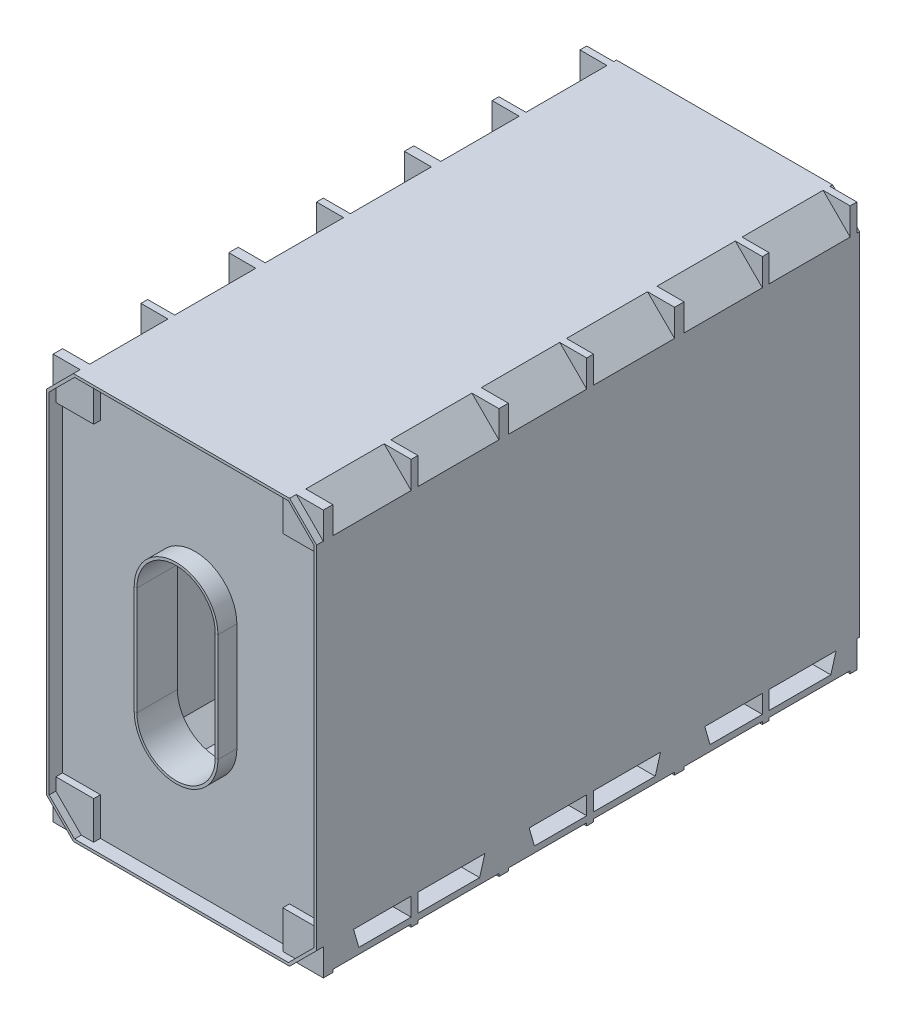
from build123d import *

# Parameters (mm, degrees)
SKETCH_1_W               = 200
SKETCH_1_H               = 300
EXTRUDE_1_DEPTH          = 2
CHAMFER_1_SIZE           = 20
EXTRUDE_2_DEPTH          = 400
PATTERN_START            = 130
PATTERN_LINEAR_1_DEPTH   = 2
PATTERN_START_2          = 260
PATTERN_LINEAR_1_2_DEPTH = 2
PATTERN_START_3          = 390
PATTERN_LINEAR_1_3_DEPTH = 2
SKETCH_4_W               = 2
SKETCH_4_H               = 30
PATTERN_LINEAR_2_COUNT   = 4
PATTERN_LINEAR_2_PITCH   = 130
EXTRUDE_7_DEPTH          = 100
PATTERN_LINEAR_3_COUNT   = 3
PATTERN_LINEAR_3_PITCH   = 130
SKETCH_6_W               = 30
SKETCH_6_H               = 30
EXTRUDE_8_DEPTH          = 5
PATTERN_LINEAR_4_COUNT   = 7
PATTERN_LINEAR_4_PITCH   = 65


# Read off the part's stored shape, not the designer's step: 阵列(线性)1
with BuildPart() as part:
    # 草图1 → 凸台-拉伸1 (new body)
    with BuildSketch(Plane.XY):
        Rectangle(SKETCH_1_W, SKETCH_1_H)
        with BuildLine():
            Line((30, 40), (30, -40))
            ThreePointArc((30, -40), (0, -70), (-30, -40))
            Line((-30, -40), (-30, 40))
            ThreePointArc((-30, 40), (0, 70), (30, 40))
        make_face(mode=Mode.SUBTRACT)
    extrude(amount=EXTRUDE_1_DEPTH)

    # 倒角1
    chamfer_1_edges = [part.edges().sort_by_distance(p)[0] for p in [
        (-100, 150, 1),
        (100, 150, 1),
        (100, -150, 1),
        (-100, -150, 1),
    ]]
    chamfer(chamfer_1_edges, length=CHAMFER_1_SIZE)

    # 草图3 → 凸台-拉伸2 (add)
    with BuildSketch(Plane.XY.offset(2)):
        Polygon((-80, -150), (80, -150), (100, -130), (100, 130), (80, 150), (-80, 150), (-100, 130), (-100, -130), align=None)
        Polygon((-79.171572875, -148), (79.171572875, -148), (98, -129.171572875), (98, 129.171572875), (79.171572875, 148), (-79.171572875, 148), (-98, 129.171572875), (-98, -129.171572875), align=None, mode=Mode.SUBTRACT)
    extrude(amount=EXTRUDE_2_DEPTH)

    # 阵列(线性)1 outline → 阵列(线性)1 (add)
    # profile 1 of 5: a face of its own
    with BuildSketch(Plane.XY.offset(PATTERN_START)):
        Polygon((100, -150), (100, -130), (80, -150), align=None)
    # profile 2 of 5: a face of its own
    with BuildSketch(Plane.XY.offset(PATTERN_START)):
        Polygon((80, 150), (100, 130), (100, 150), align=None)
    # profile 3 of 5: a face of its own
    with BuildSketch(Plane.XY.offset(PATTERN_START)):
        Polygon((-100, -150), (-80, -150), (-100, -130), align=None)
    # profile 4 of 5: a face of its own
    with BuildSketch(Plane.XY.offset(PATTERN_START)):
        Polygon((-100, 130), (-80, 150), (-100, 150), align=None)
    # profile 5 of 5: a face of its own
    with BuildSketch(Plane.XY.offset(PATTERN_START)):
        Polygon((-98, -129.171572875), (-79.171572875, -148), (79.171572875, -148), (98, -129.171572875), (98, 129.171572875), (79.171572875, 148), (-79.171572875, 148), (-98, 129.171572875), align=None)
        with BuildLine():
            Line((-30, -40), (-30, 40))
            ThreePointArc((-30, 40), (0, 70), (30, 40))
            Line((30, 40), (30, -40))
            ThreePointArc((30, -40), (0, -70), (-30, -40))
        make_face(mode=Mode.SUBTRACT)
    extrude(amount=PATTERN_LINEAR_1_DEPTH)

    # Pattern Linear 1 2 outline → Pattern Linear 1 2 (add)
    # profile 1 of 5: a face of its own
    with BuildSketch(Plane.XY.offset(PATTERN_START_2)):
        Polygon((100, -150), (100, -130), (80, -150), align=None)
    # profile 2 of 5: a face of its own
    with BuildSketch(Plane.XY.offset(PATTERN_START_2)):
        Polygon((80, 150), (100, 130), (100, 150), align=None)
    # profile 3 of 5: a face of its own
    with BuildSketch(Plane.XY.offset(PATTERN_START_2)):
        Polygon((-100, -150), (-80, -150), (-100, -130), align=None)
    # profile 4 of 5: a face of its own
    with BuildSketch(Plane.XY.offset(PATTERN_START_2)):
        Polygon((-100, 130), (-80, 150), (-100, 150), align=None)
    # profile 5 of 5: a face of its own
    with BuildSketch(Plane.XY.offset(PATTERN_START_2)):
        Polygon((-98, -129.171572875), (-79.171572875, -148), (79.171572875, -148), (98, -129.171572875), (98, 129.171572875), (79.171572875, 148), (-79.171572875, 148), (-98, 129.171572875), align=None)
        with BuildLine():
            Line((-30, -40), (-30, 40))
            ThreePointArc((-30, 40), (0, 70), (30, 40))
            Line((30, 40), (30, -40))
            ThreePointArc((30, -40), (0, -70), (-30, -40))
        make_face(mode=Mode.SUBTRACT)
    extrude(amount=PATTERN_LINEAR_1_2_DEPTH)

    # Pattern Linear 1 3 outline → Pattern Linear 1 3 (add)
    # profile 1 of 5: a face of its own
    with BuildSketch(Plane.XY.offset(PATTERN_START_3)):
        Polygon((100, -150), (100, -130), (80, -150), align=None)
    # profile 2 of 5: a face of its own
    with BuildSketch(Plane.XY.offset(PATTERN_START_3)):
        Polygon((80, 150), (100, 130), (100, 150), align=None)
    # profile 3 of 5: a face of its own
    with BuildSketch(Plane.XY.offset(PATTERN_START_3)):
        Polygon((-100, -150), (-80, -150), (-100, -130), align=None)
    # profile 4 of 5: a face of its own
    with BuildSketch(Plane.XY.offset(PATTERN_START_3)):
        Polygon((-100, 130), (-80, 150), (-100, 150), align=None)
    # profile 5 of 5: a face of its own
    with BuildSketch(Plane.XY.offset(PATTERN_START_3)):
        Polygon((-98, -129.171572875), (-79.171572875, -148), (79.171572875, -148), (98, -129.171572875), (98, 129.171572875), (79.171572875, 148), (-79.171572875, 148), (-98, 129.171572875), align=None)
        with BuildLine():
            Line((-30, -40), (-30, 40))
            ThreePointArc((-30, 40), (0, 70), (30, 40))
            Line((30, 40), (30, -40))
            ThreePointArc((30, -40), (0, -70), (-30, -40))
        make_face(mode=Mode.SUBTRACT)
    extrude(amount=PATTERN_LINEAR_1_3_DEPTH)

    # 扫描1: sweep along a curve in space
    with BuildLine() as sweep_1_path:
        Line((30, -40, 2), (30, 40, 2))
        ThreePointArc((30, 40, 2), (0, 70, 2), (-30, 40, 2))
        Line((-30, 40, 2), (-30, -40, 2))
        ThreePointArc((-30, -40, 2), (0, -70, 2), (30, -40, 2))
    # 草图4 → 扫描1 (sweep)
    with BuildSketch(Plane(origin=(30, 40, 2), x_dir=(1, 0, 0), z_dir=(0, 1, 0))):
        with Locations((0, 1)):
            Rectangle(SKETCH_4_W, SKETCH_4_H)
    sweep_1 = sweep(path=sweep_1_path.line)

    # 阵列(线性)2: 扫描1 ×4
    with Locations(*[(0, 0, i * PATTERN_LINEAR_2_PITCH) for i in range(1, PATTERN_LINEAR_2_COUNT)]):
        add(sweep_1)

    # 草图5 → 凸台-拉伸7 (add, symmetric)
    with BuildSketch(Plane(origin=(0, 0, 0), x_dir=(0, 0, -1), z_dir=(1, 0, 0))):
        with BuildLine():
            Line((-390, -71), (-390, -148))
            Line((-390, -148), (-262, -148))
            Line((-262, -148), (-262, -71))
            Line((-262, -71), (-262, -69))
            Line((-262, -69), (-268.501540663, -69))
            ThreePointArc((-268.501540663, -69), (-266.56643603, -84.799204961), (-268.893575928, -100.545440297))
            Line((-268.893575928, -100.545440297), (-281.292861703, -143.498739668))
            Line((-281.292861703, -143.498739668), (-370.707138297, -143.498739668))
            Line((-370.707138297, -143.498739668), (-383.106424072, -100.545440297))
            ThreePointArc((-383.106424072, -100.545440297), (-385.43356397, -84.799204961), (-383.498459337, -69))
            Line((-383.498459337, -69), (-390, -69))
            Line((-390, -69), (-390, -71))
        make_face()
    extrude_7 = extrude(amount=EXTRUDE_7_DEPTH, both=True)

    # 阵列(线性)3: 凸台-拉伸7 ×3
    with Locations(*[(0, 0, -i * PATTERN_LINEAR_3_PITCH) for i in range(1, PATTERN_LINEAR_3_COUNT)]):
        add(extrude_7)

    # 草图6 → 凸台-拉伸8 (add)
    with BuildSketch(Plane.XY.offset(392)):
        with Locations((85, 135)):
            Rectangle(SKETCH_6_W, SKETCH_6_H)
        with Locations((85, -135)):
            Rectangle(SKETCH_6_W, SKETCH_6_H)
        with Locations((-85, -135)):
            Rectangle(SKETCH_6_W, SKETCH_6_H)
        with Locations((-85, 135)):
            Rectangle(SKETCH_6_W, SKETCH_6_H)
    extrude_8 = extrude(amount=EXTRUDE_8_DEPTH)

    # 阵列(线性)4: 凸台-拉伸8 ×7
    with Locations(*[(0, 0, -i * PATTERN_LINEAR_4_PITCH) for i in range(1, PATTERN_LINEAR_4_COUNT)]):
        add(extrude_8)


solid = part.part
